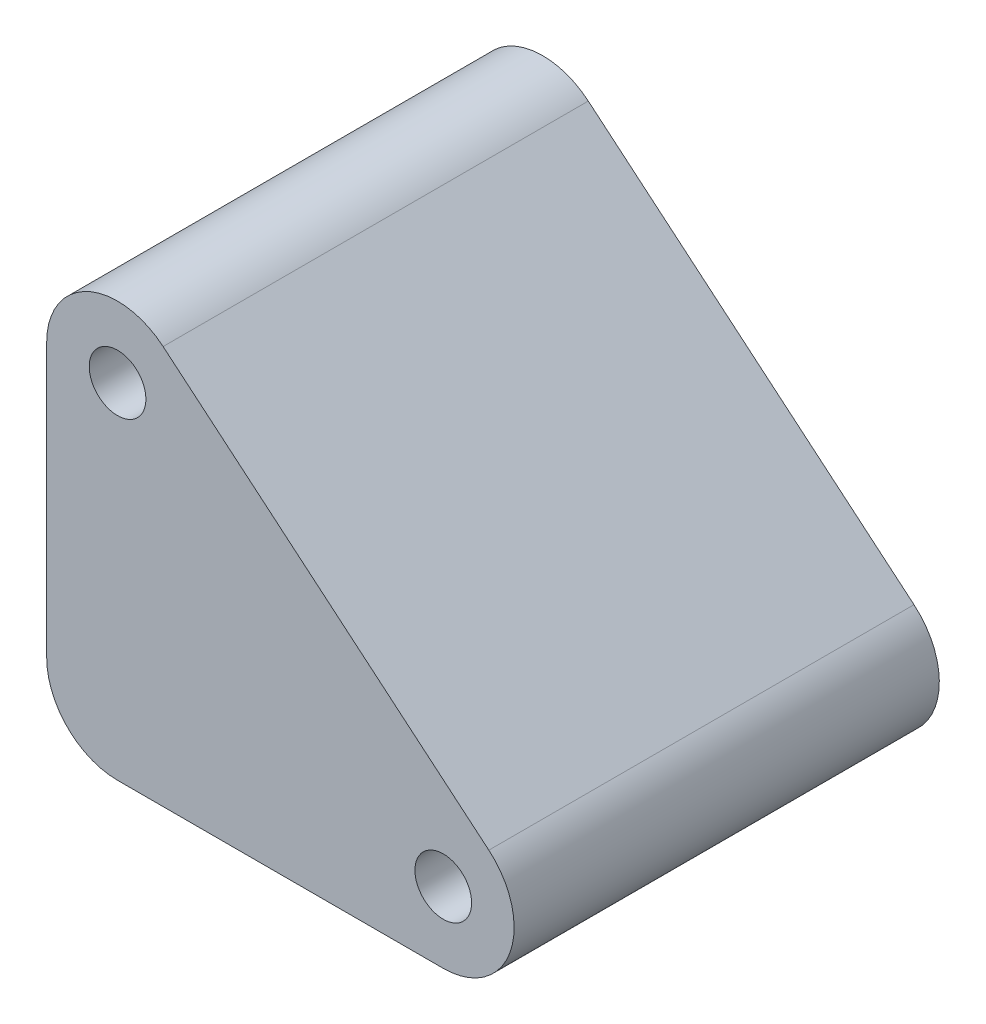
from build123d import *

# Parameters (mm, degrees)
BOSS_EXTRUDE1_DEPTH      = 15
BOSS_EXTRUDE1_DEPTH_BACK = 15
SKETCH1_R                = 2


with BuildPart() as part:
    # Sketch1 → Boss-Extrude1 (new, two sides: drawn at the far end of the back side and taken through both)
    with BuildSketch(Plane.XY.offset(-BOSS_EXTRUDE1_DEPTH_BACK)):
        with BuildLine():
            Line((-201.891878382, 158.17448712), (-178.910545088, 138.89085883))
            ThreePointArc((-178.910545088, 138.89085883), (-177.426020033, 133.350535898), (-182.124483137, 130.060636614))
            Line((-182.124483137, 130.060636614), (-205.10581643, 130.060636614))
            ThreePointArc((-205.10581643, 130.060636614), (-208.641350336, 131.525102708), (-210.10581643, 135.060636614))
            Line((-210.10581643, 135.060636614), (-210.10581643, 154.344264905))
            ThreePointArc((-210.10581643, 154.344264905), (-207.218907739, 158.87580384), (-201.891878382, 158.17448712))
        make_face()
        with Locations((-182.124483137, 135.060636614)):
            Circle(SKETCH1_R, mode=Mode.SUBTRACT)
        with Locations((-205.10581643, 154.344264905)):
            Circle(SKETCH1_R, mode=Mode.SUBTRACT)
    extrude(amount=BOSS_EXTRUDE1_DEPTH + BOSS_EXTRUDE1_DEPTH_BACK)


solid = part.part
